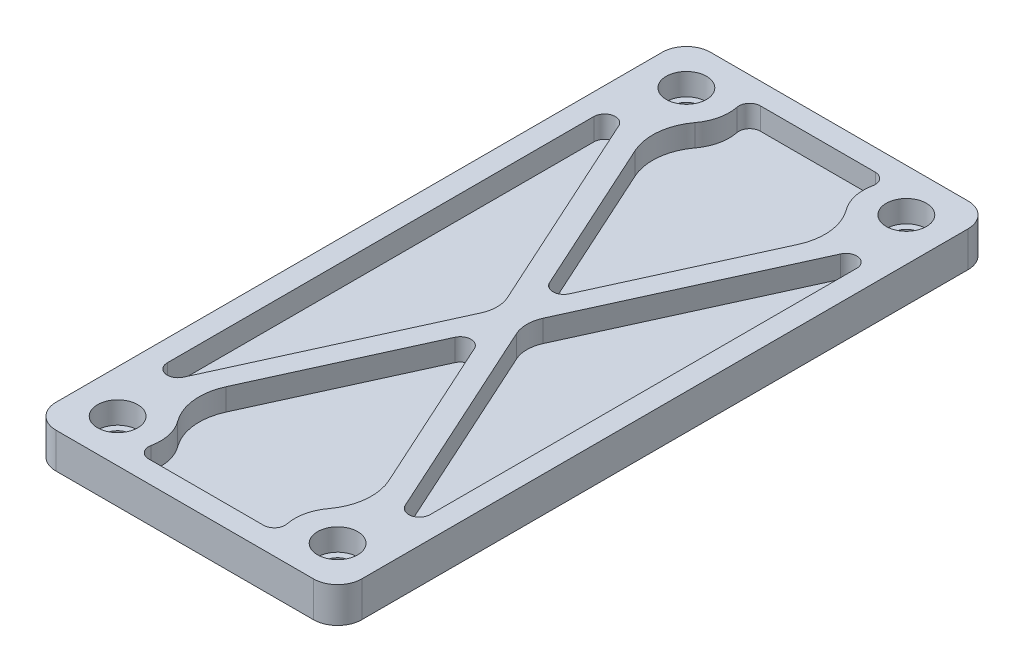
from build123d import *
from OCP.BRepFilletAPI import BRepFilletAPI_MakeFillet

# Parameters (mm, degrees)
SKETCH1_W               = 57
SKETCH1_H               = 122
BOSS_EXTRUDE1_DEPTH     = 6.6
FILLET1_R               = 4.5
SKETCH2_R               = 2.5
CUT_EXTRUDE1_DEPTH      = 68.652124874
SKETCH3_R               = 3.75
CUT_EXTRUDE2_DEPTH      = 4.1
MIRROR3_COPY_1_SKETCH_R = 2.5
MIRROR3_COPY_1_DEPTH    = 68.652124874
MIRROR3_COPY_2_SKETCH_R = 3.75
MIRROR3_COPY_2_DEPTH    = 4.1
CUT_EXTRUDE3_DEPTH      = 4.1
FILLET2_R               = 10
FILLET3_R               = 2
FILLET2_OF_MIRROR4_R    = 10
FILLET3_OF_MIRROR4_R    = 2
MIRROR5_START           = 2.5
MIRROR5_DEPTH           = 4.1
FILLET4_R1              = 2
FILLET4_R2              = 6


with BuildPart() as part:
    # Sketch1 → Boss-Extrude1 (new body)
    with BuildSketch(Plane(origin=(0, 0, 0), x_dir=(1, 0, 0), z_dir=(0, 1, 0))):
        Rectangle(SKETCH1_W, SKETCH1_H)
    extrude(amount=BOSS_EXTRUDE1_DEPTH)

    # Fillet1
    fillet1_edges = [part.edges().sort_by_distance(p)[0] for p in [
        (28.5, 3.3, 61),
        (-28.5, 3.3, 61),
        (-28.5, 3.3, -61),
        (28.5, 3.3, -61),
    ]]
    fillet(fillet1_edges, radius=FILLET1_R)

    # Sketch2 → Cut-Extrude1 (cut, through all)
    with BuildSketch(Plane(origin=(0, 6.6, 0), x_dir=(1, 0, 0), z_dir=(0, 1, 0))):
        with Locations(Location((20.5, 53, 0), (0, 0, 270))):
            Circle(SKETCH2_R)
    cut_extrude1 = extrude(amount=-CUT_EXTRUDE1_DEPTH, mode=Mode.SUBTRACT)

    # Sketch3 → Cut-Extrude2 (cut)
    with BuildSketch(Plane(origin=(0, 6.6, 0), x_dir=(1, 0, 0), z_dir=(0, 1, 0))):
        with Locations(Location((20.5, 53, 0), (0, 0, 270))):
            Circle(SKETCH3_R)
    cut_extrude2 = extrude(amount=-CUT_EXTRUDE2_DEPTH, mode=Mode.SUBTRACT)

    # Mirror1: Cut-Extrude1, Cut-Extrude2 across plane
    add(cut_extrude1.mirror(Plane(origin=(0, 0, 0), x_dir=(0, 0, 1), z_dir=(1, 0, 0))), mode=Mode.SUBTRACT)
    add(cut_extrude2.mirror(Plane(origin=(0, 0, 0), x_dir=(0, 0, 1), z_dir=(1, 0, 0))), mode=Mode.SUBTRACT)

    # Mirror3: Cut-Extrude1, Cut-Extrude2 across plane
    add(cut_extrude1.mirror(Plane.XY), mode=Mode.SUBTRACT)
    add(cut_extrude2.mirror(Plane.XY), mode=Mode.SUBTRACT)

    # Mirror3 copy 1 sketch → Mirror3 copy 1 (cut, through all)
    with BuildSketch(Plane(origin=(0, 6.6, 0), x_dir=(-1, 0, 0), z_dir=(0, 1, 0))):
        with Locations(Location((20.5, 53, 0), (0, 0, 270))):
            Circle(MIRROR3_COPY_1_SKETCH_R)
    extrude(amount=-MIRROR3_COPY_1_DEPTH, mode=Mode.SUBTRACT)

    # Mirror3 copy 2 sketch → Mirror3 copy 2 (cut)
    with BuildSketch(Plane(origin=(0, 6.6, 0), x_dir=(-1, 0, 0), z_dir=(0, 1, 0))):
        with Locations(Location((20.5, 53, 0), (0, 0, 270))):
            Circle(MIRROR3_COPY_2_SKETCH_R)
    extrude(amount=-MIRROR3_COPY_2_DEPTH, mode=Mode.SUBTRACT)

    # Sketch4 → Cut-Extrude3 (cut)
    with BuildSketch(Plane(origin=(0, 6.6, 0), x_dir=(1, 0, 0), z_dir=(0, 1, 0))):
        with BuildLine():
            Line((0, 57), (0, 4.825290504))
            Line((0, 4.825290504), (18.422458297, 45.274469567))
            ThreePointArc((18.422458297, 45.274469567), (13.107579799, 49.941875809), (13.57179677, 57))
            Line((13.57179677, 57), (0, 57))
        make_face()
        with BuildLine():
            Line((24.5, 0), (24.5, 46.07179677))
            ThreePointArc((24.5, 46.07179677), (23.697246566, 45.666677806), (22.854101194, 45.354203274))
            Line((22.854101194, 45.354203274), (2.197664208, 0))
            Line((2.197664208, 0), (24.5, 0))
        make_face()
    cut_extrude3 = extrude(amount=-CUT_EXTRUDE3_DEPTH, mode=Mode.SUBTRACT)

    # Fillet2
    # the kernel refuses this fillet: 10 mm, written as the material it adds along each edge
    with BuildSketch(Plane(origin=(22.854101194, 6.6, -45.354203274), x_dir=(0.9166652742214988, 0, -0.3996558207213108), z_dir=(0, -1, 0))) as fillet2_piece_1:
        with BuildLine():
            CenterArc((4.145887895, 9.719866853), FILLET2_R, 228.043415152, 28.362844717)
            Line((-2.539785162, 2.28335048), (-2.673498623, 2.134620152))
            Line((-2.673498623, 2.134620152), (-0.133713461, -0.148730327))
            Line((-0.133713461, -0.148730327), (0.022444109, -0.198736665))
            ThreePointArc((0.022444109, -0.198736665), (0.897764349, -0.149466597), (1.748521514, -0.194397337))
            Line((1.748521514, -0.194397337), (1.795528698, 0))
        make_face()
    extrude(amount=4.1)
    with BuildSketch(Plane(origin=(18.422458297, 6.6, -45.274469567), x_dir=(-0.41448281678671633, 0, 0.9100571380899934), z_dir=(0, -1, 0))) as fillet2_piece_2:
        with BuildLine():
            CenterArc((7.872374254, 10), FILLET2_R, 208.861826981, 61.138173019)
            Line((-0.885488916, 5.173009977), (-1.06064618, 5.076470177))
            ThreePointArc((-1.06064618, 5.076470177), (-0.203601176, 2.627440291), (-0.197294486, 0.032785449))
            Line((-0.197294486, 0.032785449), (0, -0.2))
            Line((0, -0.2), (7.872374254, -0.2))
            Line((7.872374254, -0.2), (7.872374254, 0))
        make_face()
    extrude(amount=4.1)

    # Fillet3
    # the kernel refuses this fillet: 2 mm, written as the material it adds along each edge
    with BuildSketch(Plane(origin=(13.57179677, 6.6, -57), x_dir=(-0.3545926272331019, 0, 0.9350208921259068), z_dir=(0, -1, 0))) as fillet3_piece_1:
        with BuildLine():
            CenterArc((2.887636012, 1.974096319), FILLET3_R, 159.231520484, 101.536959033)
            Line((1.017594228, 2.683281573), (0, 0))
            ThreePointArc((0, 0), (1.283393783, 0.103614726), (2.566787566, 0))
        make_face()
    extrude(amount=4.1)
    with BuildSketch(Plane(origin=(24.5, 6.6, -46.07179677), x_dir=(-0.5710655658719064, 0, 0.8209044520986588), z_dir=(0, -1, 0))) as fillet3_piece_2:
        with BuildLine():
            CenterArc((6.330546511, -1.967533641), FILLET3_R, 79.662186843, 155.513248783)
            Line((5.18841538, -3.609342545), (5.074202266, -3.773523436))
            Line((5.074202266, -3.773523436), (-0.114213113, -0.16418089))
            Line((-0.114213113, -0.16418089), (-0.061886493, 0.190184284))
            ThreePointArc((-0.061886493, 0.190184284), (4.924730005, 0.525207358), (6.725339822, 0.196753364))
            Line((6.725339822, 0.196753364), (6.689449521, 0))
        make_face()
    extrude(amount=4.1)

    # Mirror4: Cut-Extrude3 across plane
    add(cut_extrude3.mirror(Plane(origin=(0, 0, 0), x_dir=(0, 0, 1), z_dir=(1, 0, 0))), mode=Mode.SUBTRACT)

    # Fillet2 of Mirror4
    # the kernel refuses this fillet: 10 mm, written as the material it adds along each edge
    with BuildSketch(Plane(origin=(-22.854101194, 6.6, -45.354203274), x_dir=(0.4144828167867165, 0, 0.9100571380899934), z_dir=(0, -1, 0))) as fillet2_of_mirror4_piece_1:
        with BuildLine():
            CenterArc((3.415288872, 10), FILLET2_OF_MIRROR4_R, 241.637155283, 28.362844717)
            Line((-1.335247856, 1.200431784), (-1.43025859, 1.024440419))
            ThreePointArc((-1.43025859, 1.024440419), (-0.767552408, 0.489064812), (-0.149559435, -0.132785449))
            Line((-0.149559435, -0.132785449), (0, -0.2))
            Line((0, -0.2), (3.415288872, -0.2))
            Line((3.415288872, -0.2), (3.415288872, 0))
        make_face()
    extrude(amount=4.1)
    with BuildSketch(Plane(origin=(-18.422458297, 6.6, -45.274469567), x_dir=(0.8270785739825625, 0, -0.5620863211811608), z_dir=(0, -1, 0))) as fillet2_of_mirror4_piece_2:
        with BuildLine():
            CenterArc((8.528405442, 9.446723083), FILLET2_OF_MIRROR4_R, 189.713452681, 61.138173019)
            Line((-1.328233375, 7.759514966), (-1.525366151, 7.725770803))
            Line((-1.525366151, 7.725770803), (-0.197132776, -0.033744162))
            Line((-0.197132776, -0.033744162), (0.065603119, -0.188934462))
            ThreePointArc((0.065603119, -0.188934462), (2.624124751, 0.242621533), (5.182646384, -0.188934462))
            Line((5.182646384, -0.188934462), (5.248249503, 0))
        make_face()
    extrude(amount=4.1)

    # Fillet3 of Mirror4
    # the kernel refuses this fillet: 2 mm, written as the material it adds along each edge
    with BuildSketch(Plane(origin=(-13.57179677, 6.6, -57), x_dir=(0.35459262723310125, 0, 0.935020892125907), z_dir=(0, -1, 0))) as fillet3_of_mirror4_piece_1:
        with BuildLine():
            CenterArc((2.887636012, -1.974096319), FILLET3_OF_MIRROR4_R, 99.231520484, 101.536959033)
            Line((1.017594228, -2.683281573), (0, 0))
            ThreePointArc((0, 0), (1.283393783, -0.103614726), (2.566787566, 0))
        make_face()
    extrude(amount=4.1)
    with BuildSketch(Plane(origin=(-24.5, 6.6, -46.07179677), x_dir=(0.5710655658719064, 0, 0.8209044520986588), z_dir=(0, -1, 0))) as fillet3_of_mirror4_piece_2:
        with BuildLine():
            CenterArc((6.330546511, 1.967533641), FILLET3_OF_MIRROR4_R, 124.824564374, 155.513248783)
            Line((5.18841538, 3.609342545), (5.074202266, 3.773523436))
            Line((5.074202266, 3.773523436), (-0.114213113, 0.16418089))
            Line((-0.114213113, 0.16418089), (-0.061886493, -0.190184284))
            ThreePointArc((-0.061886493, -0.190184284), (4.924730005, -0.525207358), (6.725339822, -0.196753364))
            Line((6.725339822, -0.196753364), (6.689449521, 0))
        make_face()
    extrude(amount=4.1)

    # Mirror5: read off the stored shape, not the designer's step
    # Mirror5 outline → Mirror5 (cut)
    with BuildSketch(Plane(origin=(0, 0, 0), x_dir=(1, 0, 0), z_dir=(0, 1, 0)).offset(MIRROR5_START)):
        with BuildLine():
            Line((-20.679885724, -40.580397876), (-2.197664208, 0))
            Line((-2.197664208, 0), (-24.5, 0))
            Line((-24.5, 0), (-24.5, -39.751432242))
            ThreePointArc((-24.5, -39.751432242), (-22.924129372, -41.705943505), (-20.679885724, -40.580397876))
        make_face()
        with BuildLine():
            ThreePointArc((20.679885724, -40.580397876), (22.924129372, -41.705943505), (24.5, -39.751432242))
            Line((24.5, -39.751432242), (24.5, 0))
            Line((24.5, 0), (2.197664208, 0))
            Line((2.197664208, 0), (20.679885724, -40.580397876))
        make_face()
        with BuildLine():
            Line((15.159494442, -38.110159183), (0, -4.825290504))
            Line((0, -4.825290504), (-15.159494442, -38.110159183))
            ThreePointArc((-15.159494442, -38.110159183), (-16.002629649, -43.314562397), (-14.081743582, -48.224438823))
            ThreePointArc((-14.081743582, -48.224438823), (-12.69136541, -51.260682364), (-12.661632823, -54.6))
            ThreePointArc((-12.661632823, -54.6), (-12.251234367, -56.264911064), (-10.702041029, -57))
            Line((-10.702041029, -57), (10.702041029, -57))
            ThreePointArc((10.702041029, -57), (12.251234367, -56.264911064), (12.661632823, -54.6))
            ThreePointArc((12.661632823, -54.6), (12.69136541, -51.260682364), (14.081743582, -48.224438823))
            ThreePointArc((14.081743582, -48.224438823), (16.002629649, -43.314562397), (15.159494442, -38.110159183))
        make_face()
    extrude(amount=MIRROR5_DEPTH, mode=Mode.SUBTRACT)

    # Fillet4: one fillet with a radius per group of edges: ONE call of the kernel's fillet builder (fillet() takes one radius for all edges)
    fillet4_edges_1 = [part.edges().sort_by_distance(p)[0] for p in [
        (0, 4.55, -4.825290504),
        (0, 4.55, 4.825290504),
    ]]
    fillet4_edges_2 = [part.edges().sort_by_distance(p)[0] for p in [
        (-2.197664208, 4.55, 0),
        (2.197664208, 4.55, 0),
    ]]
    fillet4 = BRepFilletAPI_MakeFillet(part.part.solid().wrapped)
    for e in fillet4_edges_1:
        fillet4.Add(FILLET4_R1, e.wrapped)
    for e in fillet4_edges_2:
        fillet4.Add(FILLET4_R2, e.wrapped)
    add(Compound.cast(fillet4.Shape()), mode=Mode.REPLACE)


solid = part.part
